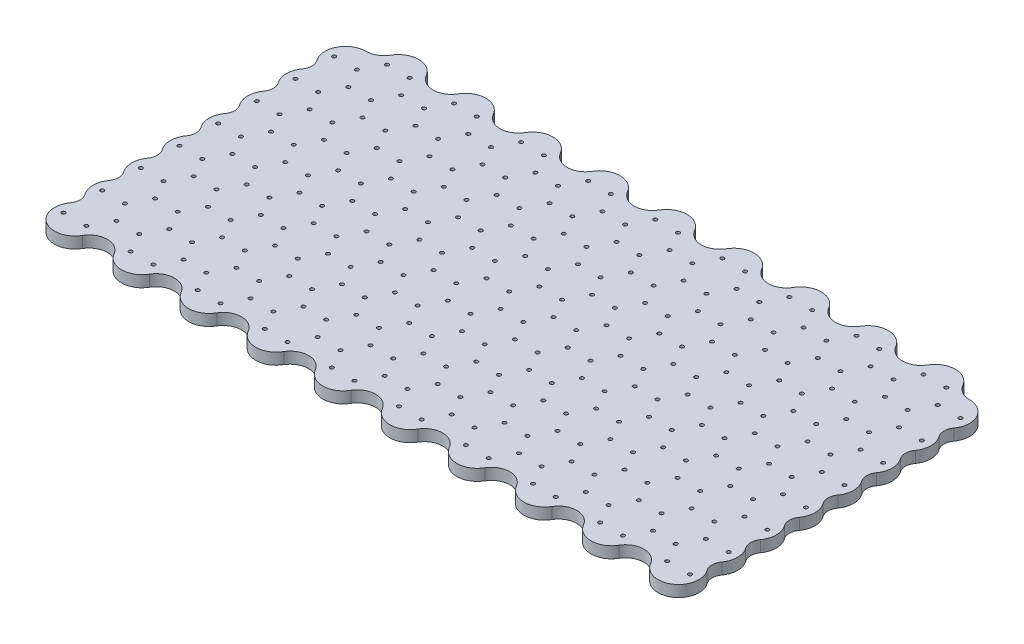
from build123d import *

# Parameters (mm, degrees)
AUFSATZ_LINEAR_AUSTRAGEN1_DEPTH = 5
SKIZZE2_R                       = 0.80000094
SCHNITT_LINEAR_AUSTRAGEN4_DEPTH = 237.30295198


with BuildPart() as part:
    # Skizze1 → Aufsatz-Linear austragen1 (new body)
    with BuildSketch(Plane(origin=(0, 0, 0), x_dir=(1, 0, 0), z_dir=(0, 1, 0))):
        with BuildLine():
            ThreePointArc((124.91553877, 48.070452206), (128.214927687, 44.726160241), (132.749999179, 43.500035234))
            ThreePointArc((132.749999179, 43.500035234), (140.744525423, 48.366339395), (140.093758122, 57.702819887))
            ThreePointArc((140.093758122, 57.702819887), (138.999081305, 61.000027141), (140.093758122, 64.297234395))
            ThreePointArc((140.093758122, 64.297234395), (141.32594072, 66.770002756), (141.749986955, 69.500028784))
            ThreePointArc((141.749986955, 69.500028784), (141.325938231, 72.230052813), (140.093754311, 74.702818735))
            ThreePointArc((140.093754311, 74.702818735), (138.99907647, 78.00002638), (140.093753094, 81.297234429))
            ThreePointArc((140.093753094, 81.297234429), (141.325935562, 83.770001959), (141.749982202, 86.500027112))
            ThreePointArc((141.749982202, 86.500027112), (141.325933853, 89.23005221), (140.093749716, 91.702819141))
            ThreePointArc((140.093749716, 91.702819141), (138.999072964, 95.000026021), (140.093749502, 98.297232972))
            ThreePointArc((140.093749502, 98.297232972), (141.32593197, 100.770000502), (141.74997861, 103.500025655))
            ThreePointArc((141.74997861, 103.500025655), (141.325930204, 106.230050932), (140.093745907, 108.702817989))
            ThreePointArc((140.093745907, 108.702817989), (138.999068066, 112.000025634), (140.09374469, 115.297233683))
            ThreePointArc((140.09374469, 115.297233683), (141.325927158, 117.770001213), (141.749973798, 120.500026366))
            ThreePointArc((141.749973798, 120.500026366), (141.325925449, 123.230051465), (140.093741312, 125.702818395))
            ThreePointArc((140.093741312, 125.702818395), (138.99906456, 129.000025275), (140.093741097, 132.297232226))
            ThreePointArc((140.093741097, 132.297232226), (141.325923565, 134.769999756), (141.749970205, 137.500024909))
            ThreePointArc((141.749970205, 137.500024909), (141.325921857, 140.230050008), (140.093737719, 142.702816938))
            ThreePointArc((140.093737719, 142.702816938), (138.999060902, 146.000024192), (140.093737719, 149.297231446))
            ThreePointArc((140.093737719, 149.297231446), (141.325919932, 151.769998598), (141.749966552, 154.500023296))
            ThreePointArc((141.749966552, 154.500023296), (141.325918528, 157.230047667), (140.093735107, 159.702814095))
            ThreePointArc((140.093735107, 159.702814095), (138.999100076, 163.000031939), (140.093814881, 166.297223297))
            ThreePointArc((140.093814881, 166.297223297), (140.7445807, 175.633710262), (132.750048262, 180.500016467))
            ThreePointArc((132.750048262, 180.500016467), (128.773042213, 181.551022776), (125.834510081, 184.429602337))
            ThreePointArc((125.834510081, 184.429602337), (122.535119401, 187.773893559), (118.0000473, 189.000019034))
            ThreePointArc((118.0000473, 189.000019034), (113.464976154, 187.773894117), (110.165585607, 184.429604261))
            ThreePointArc((110.165585607, 184.429604261), (107.227053085, 181.55102406), (103.250046244, 180.5000179))
            ThreePointArc((103.250046244, 180.5000179), (99.2730398, 181.551023834), (96.334507348, 184.429603476))
            ThreePointArc((96.334507348, 184.429603476), (93.035117029, 187.77389557), (88.50004465, 189.000021419))
            ThreePointArc((88.50004465, 189.000021419), (83.964973226, 187.773896127), (80.66558304, 184.429605401))
            ThreePointArc((80.66558304, 184.429605401), (77.72705055, 181.551025722), (73.750044055, 180.500019774))
            ThreePointArc((73.750044055, 180.500019774), (69.77303906, 181.551024869), (66.834506836, 184.429602437))
            ThreePointArc((66.834506836, 184.429602437), (63.535116518, 187.773894526), (59.000044142, 189.000020373))
            ThreePointArc((59.000044142, 189.000020373), (54.464972717, 187.773895081), (51.165582532, 184.429604355))
            ThreePointArc((51.165582532, 184.429604355), (48.227050241, 181.551024871), (44.250044015, 180.500018995))
            ThreePointArc((44.250044015, 180.500018995), (40.273039303, 181.551024011), (37.334507281, 184.429601364))
            ThreePointArc((37.334507281, 184.429601364), (34.035117292, 187.77389382), (29.50004493, 189.000019833))
            ThreePointArc((29.50004493, 189.000019833), (24.964974603, 187.773895007), (21.665584898, 184.429605465))
            ThreePointArc((21.665584898, 184.429605465), (18.727052209, 181.551025591), (14.750045444, 180.500019572))
            ThreePointArc((14.750045444, 180.500019572), (10.773039627, 181.551025052), (7.834507107, 184.429603591))
            ThreePointArc((7.834507107, 184.429603591), (4.535116988, 187.773895481), (4.4883e-05, 189.000021256))
            ThreePointArc((4.4883e-05, 189.000021256), (-4.535026263, 187.77389604), (-7.834416249, 184.429605522))
            ThreePointArc((-7.834416249, 184.429605522), (-10.772948771, 181.55102532), (-14.749955612, 180.500019161))
            ThreePointArc((-14.749955612, 180.500019161), (-18.726962056, 181.551025094), (-21.665494507, 184.429604737))
            ThreePointArc((-21.665494507, 184.429604737), (-24.964884922, 187.773895694), (-29.499956661, 189.000021072))
            ThreePointArc((-29.499956661, 189.000021072), (-34.035027446, 187.773896252), (-37.334417727, 184.429606661))
            ThreePointArc((-37.334417727, 184.429606661), (-40.272950615, 181.551026592), (-44.249957649, 180.500020502))
            ThreePointArc((-44.249957649, 180.500020502), (-48.226963749, 181.551026061), (-51.165496471, 184.429604814))
            ThreePointArc((-51.165496471, 184.429604814), (-54.464886685, 187.773895565), (-58.999958147, 189.000020866))
            ThreePointArc((-58.999958147, 189.000020866), (-63.535028653, 187.773896122), (-66.834418734, 184.429606739))
            ThreePointArc((-66.834418734, 184.429606739), (-69.772951257, 181.551026537), (-73.749958098, 180.500020378))
            ThreePointArc((-73.749958098, 180.500020378), (-77.726964541, 181.551026312), (-80.665496993, 184.429605954))
            ThreePointArc((-80.665496993, 184.429605954), (-83.964887112, 187.773897844), (-88.499959217, 189.000023619))
            ThreePointArc((-88.499959217, 189.000023619), (-93.035030363, 187.773898403), (-96.334420348, 184.429607885))
            ThreePointArc((-96.334420348, 184.429607885), (-99.27295287, 181.551027683), (-103.249959711, 180.500021524))
            ThreePointArc((-103.249959711, 180.500021524), (-107.226966155, 181.551027457), (-110.165498607, 184.4296071))
            ThreePointArc((-110.165498607, 184.4296071), (-113.464888926, 187.773899193), (-117.999961305, 189.000025042))
            ThreePointArc((-117.999961305, 189.000025042), (-122.535032729, 187.77389975), (-125.834422915, 184.429609024))
            ThreePointArc((-125.834422915, 184.429609024), (-128.772955367, 181.551029382), (-132.74996181, 180.500023448))
            ThreePointArc((-132.74996181, 180.500023448), (-140.744495653, 175.633717498), (-140.093729816, 166.297229465))
            ThreePointArc((-140.093729816, 166.297229465), (-138.999053343, 163.000022888), (-140.093729816, 159.702816312))
            ThreePointArc((-140.093729816, 159.702816312), (-141.325913281, 157.230049795), (-141.74996132, 154.500025326))
            ThreePointArc((-141.74996132, 154.500025326), (-141.325914628, 151.770000352), (-140.093732212, 149.297232985))
            ThreePointArc((-140.093732212, 149.297232985), (-138.999055588, 146.000024936), (-140.09373343, 142.702817292))
            ThreePointArc((-140.09373343, 142.702817292), (-141.325916851, 140.230050863), (-141.749964875, 137.500026492))
            ThreePointArc((-141.749964875, 137.500026492), (-141.325918255, 134.770001794), (-140.093736042, 132.297234643))
            ThreePointArc((-140.093736042, 132.297234643), (-138.999059139, 129.000026291), (-140.093737046, 125.702818272))
            ThreePointArc((-140.093737046, 125.702818272), (-141.325920467, 123.230051843), (-141.749968491, 120.500027472))
            ThreePointArc((-141.749968491, 120.500027472), (-141.325921871, 117.770002774), (-140.093739658, 115.297235623))
            ThreePointArc((-140.093739658, 115.297235623), (-138.999062841, 112.000028368), (-140.093739658, 108.702821114))
            ThreePointArc((-140.093739658, 108.702821114), (-141.325924679, 106.23005348), (-141.749973342, 103.500027394))
            ThreePointArc((-141.749973342, 103.500027394), (-141.325926702, 100.770002241), (-140.093744234, 98.297234711))
            ThreePointArc((-140.093744234, 98.297234711), (-138.99906761, 95.000026662), (-140.093745452, 91.702819017))
            ThreePointArc((-140.093745452, 91.702819017), (-141.325928873, 89.230052589), (-141.749976897, 86.500028218))
            ThreePointArc((-141.749976897, 86.500028218), (-141.325930277, 83.77000352), (-140.093748064, 81.297236368))
            ThreePointArc((-140.093748064, 81.297236368), (-138.999071247, 78.000029114), (-140.093748064, 74.70282186))
            ThreePointArc((-140.093748064, 74.70282186), (-141.325933042, 72.230054314), (-141.749981689, 69.500028326))
            ThreePointArc((-141.749981689, 69.500028326), (-141.325935121, 66.770003448), (-140.093752857, 64.297236134))
            ThreePointArc((-140.093752857, 64.297236134), (-138.99907604, 61.00002888), (-140.093752857, 57.702821626))
            ThreePointArc((-140.093752857, 57.702821626), (-140.74451982, 48.366336486), (-132.749988605, 43.500031618))
            ThreePointArc((-132.749988605, 43.500031618), (-128.214916303, 44.726158045), (-124.915527163, 48.070451408))
            ThreePointArc((-124.915527163, 48.070451408), (-121.976994711, 50.94903105), (-117.999988268, 52.000036984))
            ThreePointArc((-117.999988268, 52.000036984), (-114.02298144, 50.949030832), (-111.084448921, 48.07045065))
            ThreePointArc((-111.084448921, 48.07045065), (-107.78506094, 44.726158526), (-103.249990501, 43.500031703))
            ThreePointArc((-103.249990501, 43.500031703), (-98.714917302, 44.726157173), (-95.415527145, 48.070450399))
            ThreePointArc((-95.415527145, 48.070450399), (-92.476994693, 50.949030041), (-88.499988249, 52.000035975))
            ThreePointArc((-88.499988249, 52.000035975), (-84.522981408, 50.949029815), (-81.584448886, 48.070449614))
            ThreePointArc((-81.584448886, 48.070449614), (-78.28506064, 44.726157224), (-73.749989839, 43.500030305))
            ThreePointArc((-73.749989839, 43.500030305), (-69.214915735, 44.726156188), (-65.915525236, 48.070450456))
            ThreePointArc((-65.915525236, 48.070450456), (-62.976993214, 50.94902781), (-58.999988502, 52.000032826))
            ThreePointArc((-58.999988502, 52.000032826), (-55.022982276, 50.949026949), (-52.084449985, 48.070447465))
            ThreePointArc((-52.084449985, 48.070447465), (-48.785061388, 44.726155884), (-44.249990604, 43.500030167))
            ThreePointArc((-44.249990604, 43.500030167), (-39.714918865, 44.726156441), (-36.415530134, 48.07044939))
            ThreePointArc((-36.415530134, 48.07044939), (-33.476997682, 50.949029032), (-29.499991239, 52.000034966))
            ThreePointArc((-29.499991239, 52.000034966), (-25.522984412, 50.949028814), (-22.584451892, 48.070448632))
            ThreePointArc((-22.584451892, 48.070448632), (-19.285063295, 44.726157051), (-14.74999251, 43.500031334))
            ThreePointArc((-14.74999251, 43.500031334), (-10.214920771, 44.726157608), (-6.91553204, 48.070450557))
            ThreePointArc((-6.91553204, 48.070450557), (-3.976999589, 50.949030199), (6.855e-06, 52.000036133))
            ThreePointArc((6.855e-06, 52.000036133), (3.977013682, 50.949029981), (6.915546202, 48.070449799))
            ThreePointArc((6.915546202, 48.070449799), (10.21493528, 44.726157034), (14.750007161, 43.500030852))
            ThreePointArc((14.750007161, 43.500030852), (19.285079457, 44.726157276), (22.584468593, 48.070450636))
            ThreePointArc((22.584468593, 48.070450636), (25.523001045, 50.949030278), (29.500007489, 52.000036211))
            ThreePointArc((29.500007489, 52.000036211), (33.47701433, 50.949030052), (36.415546852, 48.07044985))
            ThreePointArc((36.415546852, 48.07044985), (39.714935249, 44.726158477), (44.250005755, 43.500032836))
            ThreePointArc((44.250005755, 43.500032836), (48.785077217, 44.726159034), (52.084465747, 48.070451775))
            ThreePointArc((52.084465747, 48.070451775), (55.02299797, 50.949029343), (59.000002966, 52.000034438))
            ThreePointArc((59.000002966, 52.000034438), (62.977009461, 50.949028491), (65.915541951, 48.070448811))
            ThreePointArc((65.915541951, 48.070448811), (69.214930548, 44.726157231), (73.750001332, 43.500031514))
            ThreePointArc((73.750001332, 43.500031514), (78.285073071, 44.726157788), (81.584461802, 48.070450736))
            ThreePointArc((81.584461802, 48.070450736), (84.522994254, 50.949030378), (88.500000697, 52.000036312))
            ThreePointArc((88.500000697, 52.000036312), (92.477007525, 50.94903016), (95.415540044, 48.070449978))
            ThreePointArc((95.415540044, 48.070449978), (98.714929739, 44.726157758), (103.250001966, 43.500032681))
            ThreePointArc((103.250001966, 43.500032681), (107.785072802, 44.72615991), (111.084460511, 48.070452991))
            ThreePointArc((111.084460511, 48.070452991), (114.022992963, 50.949032633), (117.999999406, 52.000038567))
            ThreePointArc((117.999999406, 52.000038567), (121.977006247, 50.949032408), (124.91553877, 48.070452206))
        make_face()
    extrude(amount=AUFSATZ_LINEAR_AUSTRAGEN1_DEPTH)

    # Skizze2 → Schnitt-Linear austragen4 (cut, through all)
    with BuildSketch(Plane(origin=(0, 0, 0), x_dir=(1, 0, 0), z_dir=(0, 1, 0))):
        with Locations((-137.74998532, 171.50002632)):
            Circle(SKIZZE2_R)
        with Locations((-127.749985, 171.50002632)):
            Circle(SKIZZE2_R)
        with Locations((-127.749985, 154.50002476)):
            Circle(SKIZZE2_R)
        with Locations((-137.74998532, 154.50002476)):
            Circle(SKIZZE2_R)
        with Locations((-127.749985, 137.50002574)):
            Circle(SKIZZE2_R)
        with Locations((-137.74998532, 137.50002574)):
            Circle(SKIZZE2_R)
        with Locations((-127.749985, 120.50002672)):
            Circle(SKIZZE2_R)
        with Locations((-137.74998532, 120.50002672)):
            Circle(SKIZZE2_R)
        with Locations((-127.749985, 103.50002516)):
            Circle(SKIZZE2_R)
        with Locations((-137.74998532, 103.50002516)):
            Circle(SKIZZE2_R)
        with Locations((-137.74998532, 86.50002614)):
            Circle(SKIZZE2_R)
        with Locations((-127.749985, 86.50002614)):
            Circle(SKIZZE2_R)
        with Locations((-137.74998532, 69.50002458)):
            Circle(SKIZZE2_R)
        with Locations((-127.749985, 69.50002458)):
            Circle(SKIZZE2_R)
        with Locations((-137.74998532, 52.50002556)):
            Circle(SKIZZE2_R)
        with Locations((-127.749985, 52.50002556)):
            Circle(SKIZZE2_R)
        with Locations((-122.99998434, 180.0000271)):
            Circle(SKIZZE2_R)
        with Locations((-112.99998402, 180.0000271)):
            Circle(SKIZZE2_R)
        with Locations((-112.99998402, 163.00002554)):
            Circle(SKIZZE2_R)
        with Locations((-122.99998434, 163.00002554)):
            Circle(SKIZZE2_R)
        with Locations((-112.99998402, 146.00002652)):
            Circle(SKIZZE2_R)
        with Locations((-122.99998434, 146.00002652)):
            Circle(SKIZZE2_R)
        with Locations((-112.99998402, 129.0000275)):
            Circle(SKIZZE2_R)
        with Locations((-122.99998434, 129.0000275)):
            Circle(SKIZZE2_R)
        with Locations((-112.99998402, 112.00002594)):
            Circle(SKIZZE2_R)
        with Locations((-122.99998434, 112.00002594)):
            Circle(SKIZZE2_R)
        with Locations((-122.99998434, 95.00002692)):
            Circle(SKIZZE2_R)
        with Locations((-112.99998402, 95.00002692)):
            Circle(SKIZZE2_R)
        with Locations((-122.99998434, 78.00002536)):
            Circle(SKIZZE2_R)
        with Locations((-112.99998402, 78.00002536)):
            Circle(SKIZZE2_R)
        with Locations((-122.99998434, 61.00002634)):
            Circle(SKIZZE2_R)
        with Locations((-112.99998402, 61.00002634)):
            Circle(SKIZZE2_R)
        with Locations((-108.24998336, 171.50002632)):
            Circle(SKIZZE2_R)
        with Locations((-98.24998304, 171.50002632)):
            Circle(SKIZZE2_R)
        with Locations((-98.24998304, 154.50002476)):
            Circle(SKIZZE2_R)
        with Locations((-108.24998336, 154.50002476)):
            Circle(SKIZZE2_R)
        with Locations((-98.24998304, 137.50002574)):
            Circle(SKIZZE2_R)
        with Locations((-108.24998336, 137.50002574)):
            Circle(SKIZZE2_R)
        with Locations((-98.24998304, 120.50002672)):
            Circle(SKIZZE2_R)
        with Locations((-108.24998336, 120.50002672)):
            Circle(SKIZZE2_R)
        with Locations((-98.24998304, 103.50002516)):
            Circle(SKIZZE2_R)
        with Locations((-108.24998336, 103.50002516)):
            Circle(SKIZZE2_R)
        with Locations((-108.24998336, 86.50002614)):
            Circle(SKIZZE2_R)
        with Locations((-98.24998304, 86.50002614)):
            Circle(SKIZZE2_R)
        with Locations((-108.24998336, 69.50002458)):
            Circle(SKIZZE2_R)
        with Locations((-98.24998304, 69.50002458)):
            Circle(SKIZZE2_R)
        with Locations((-108.24998336, 52.50002556)):
            Circle(SKIZZE2_R)
        with Locations((-98.24998304, 52.50002556)):
            Circle(SKIZZE2_R)
        with Locations((-93.49998492, 180.0000271)):
            Circle(SKIZZE2_R)
        with Locations((-83.4999846, 180.0000271)):
            Circle(SKIZZE2_R)
        with Locations((-83.4999846, 163.00002554)):
            Circle(SKIZZE2_R)
        with Locations((-93.49998492, 163.00002554)):
            Circle(SKIZZE2_R)
        with Locations((-83.4999846, 146.00002652)):
            Circle(SKIZZE2_R)
        with Locations((-93.49998492, 146.00002652)):
            Circle(SKIZZE2_R)
        with Locations((-83.4999846, 129.0000275)):
            Circle(SKIZZE2_R)
        with Locations((-93.49998492, 129.0000275)):
            Circle(SKIZZE2_R)
        with Locations((-83.4999846, 112.00002594)):
            Circle(SKIZZE2_R)
        with Locations((-93.49998492, 112.00002594)):
            Circle(SKIZZE2_R)
        with Locations((-93.49998492, 95.00002692)):
            Circle(SKIZZE2_R)
        with Locations((-83.4999846, 95.00002692)):
            Circle(SKIZZE2_R)
        with Locations((-93.49998492, 78.00002536)):
            Circle(SKIZZE2_R)
        with Locations((-83.4999846, 78.00002536)):
            Circle(SKIZZE2_R)
        with Locations((-93.49998492, 61.00002634)):
            Circle(SKIZZE2_R)
        with Locations((-83.4999846, 61.00002634)):
            Circle(SKIZZE2_R)
        with Locations((-78.74998394, 171.50002632)):
            Circle(SKIZZE2_R)
        with Locations((-68.74998362, 171.50002632)):
            Circle(SKIZZE2_R)
        with Locations((-68.74998362, 154.50002476)):
            Circle(SKIZZE2_R)
        with Locations((-78.74998394, 154.50002476)):
            Circle(SKIZZE2_R)
        with Locations((-68.74998362, 137.50002574)):
            Circle(SKIZZE2_R)
        with Locations((-78.74998394, 137.50002574)):
            Circle(SKIZZE2_R)
        with Locations((-68.74998362, 120.50002672)):
            Circle(SKIZZE2_R)
        with Locations((-78.74998394, 120.50002672)):
            Circle(SKIZZE2_R)
        with Locations((-68.74998362, 103.50002516)):
            Circle(SKIZZE2_R)
        with Locations((-78.74998394, 103.50002516)):
            Circle(SKIZZE2_R)
        with Locations((-78.74998394, 86.50002614)):
            Circle(SKIZZE2_R)
        with Locations((-68.74998362, 86.50002614)):
            Circle(SKIZZE2_R)
        with Locations((-78.74998394, 69.50002458)):
            Circle(SKIZZE2_R)
        with Locations((-68.74998362, 69.50002458)):
            Circle(SKIZZE2_R)
        with Locations((-78.74998394, 52.50002556)):
            Circle(SKIZZE2_R)
        with Locations((-68.74998362, 52.50002556)):
            Circle(SKIZZE2_R)
        with Locations((-63.9999855, 180.00002456)):
            Circle(SKIZZE2_R)
        with Locations((-53.99998518, 180.00002456)):
            Circle(SKIZZE2_R)
        with Locations((-53.99998518, 163.000023)):
            Circle(SKIZZE2_R)
        with Locations((-63.9999855, 163.000023)):
            Circle(SKIZZE2_R)
        with Locations((-53.99998518, 146.00002398)):
            Circle(SKIZZE2_R)
        with Locations((-63.9999855, 146.00002398)):
            Circle(SKIZZE2_R)
        with Locations((-53.99998518, 129.00002496)):
            Circle(SKIZZE2_R)
        with Locations((-63.9999855, 129.00002496)):
            Circle(SKIZZE2_R)
        with Locations((-53.99998518, 112.0000234)):
            Circle(SKIZZE2_R)
        with Locations((-63.9999855, 112.0000234)):
            Circle(SKIZZE2_R)
        with Locations((-63.9999855, 95.00002438)):
            Circle(SKIZZE2_R)
        with Locations((-53.99998518, 95.00002438)):
            Circle(SKIZZE2_R)
        with Locations((-63.9999855, 78.00002282)):
            Circle(SKIZZE2_R)
        with Locations((-53.99998518, 78.00002282)):
            Circle(SKIZZE2_R)
        with Locations((-63.9999855, 61.0000238)):
            Circle(SKIZZE2_R)
        with Locations((-53.99998518, 61.0000238)):
            Circle(SKIZZE2_R)
        with Locations((-49.24998452, 171.50002632)):
            Circle(SKIZZE2_R)
        with Locations((-39.2499842, 171.50002632)):
            Circle(SKIZZE2_R)
        with Locations((-39.2499842, 154.50002476)):
            Circle(SKIZZE2_R)
        with Locations((-49.24998452, 154.50002476)):
            Circle(SKIZZE2_R)
        with Locations((-39.2499842, 137.50002574)):
            Circle(SKIZZE2_R)
        with Locations((-49.24998452, 137.50002574)):
            Circle(SKIZZE2_R)
        with Locations((-39.2499842, 120.50002672)):
            Circle(SKIZZE2_R)
        with Locations((-49.24998452, 120.50002672)):
            Circle(SKIZZE2_R)
        with Locations((-39.2499842, 103.50002516)):
            Circle(SKIZZE2_R)
        with Locations((-49.24998452, 103.50002516)):
            Circle(SKIZZE2_R)
        with Locations((-49.24998452, 86.50002614)):
            Circle(SKIZZE2_R)
        with Locations((-39.2499842, 86.50002614)):
            Circle(SKIZZE2_R)
        with Locations((-49.24998452, 69.50002458)):
            Circle(SKIZZE2_R)
        with Locations((-39.2499842, 69.50002458)):
            Circle(SKIZZE2_R)
        with Locations((-49.24998452, 52.50002556)):
            Circle(SKIZZE2_R)
        with Locations((-39.2499842, 52.50002556)):
            Circle(SKIZZE2_R)
        with Locations((-34.49998354, 180.00002456)):
            Circle(SKIZZE2_R)
        with Locations((-24.49998322, 180.00002456)):
            Circle(SKIZZE2_R)
        with Locations((-24.49998322, 163.000023)):
            Circle(SKIZZE2_R)
        with Locations((-34.49998354, 163.000023)):
            Circle(SKIZZE2_R)
        with Locations((-24.49998322, 146.00002398)):
            Circle(SKIZZE2_R)
        with Locations((-34.49998354, 146.00002398)):
            Circle(SKIZZE2_R)
        with Locations((-24.49998322, 129.00002496)):
            Circle(SKIZZE2_R)
        with Locations((-34.49998354, 129.00002496)):
            Circle(SKIZZE2_R)
        with Locations((-24.49998322, 112.0000234)):
            Circle(SKIZZE2_R)
        with Locations((-34.49998354, 112.0000234)):
            Circle(SKIZZE2_R)
        with Locations((-34.49998354, 95.00002438)):
            Circle(SKIZZE2_R)
        with Locations((-24.49998322, 95.00002438)):
            Circle(SKIZZE2_R)
        with Locations((-34.49998354, 78.00002282)):
            Circle(SKIZZE2_R)
        with Locations((-24.49998322, 78.00002282)):
            Circle(SKIZZE2_R)
        with Locations((-34.49998354, 61.0000238)):
            Circle(SKIZZE2_R)
        with Locations((-24.49998322, 61.0000238)):
            Circle(SKIZZE2_R)
        with Locations((-19.7499851, 171.50002632)):
            Circle(SKIZZE2_R)
        with Locations((-9.74998478, 171.50002632)):
            Circle(SKIZZE2_R)
        with Locations((-9.74998478, 154.50002476)):
            Circle(SKIZZE2_R)
        with Locations((-19.7499851, 154.50002476)):
            Circle(SKIZZE2_R)
        with Locations((-9.74998478, 137.50002574)):
            Circle(SKIZZE2_R)
        with Locations((-19.7499851, 137.50002574)):
            Circle(SKIZZE2_R)
        with Locations((-9.74998478, 120.50002672)):
            Circle(SKIZZE2_R)
        with Locations((-19.7499851, 120.50002672)):
            Circle(SKIZZE2_R)
        with Locations((-9.74998478, 103.50002516)):
            Circle(SKIZZE2_R)
        with Locations((-19.7499851, 103.50002516)):
            Circle(SKIZZE2_R)
        with Locations((-19.7499851, 86.50002614)):
            Circle(SKIZZE2_R)
        with Locations((-9.74998478, 86.50002614)):
            Circle(SKIZZE2_R)
        with Locations((-19.7499851, 69.50002458)):
            Circle(SKIZZE2_R)
        with Locations((-9.74998478, 69.50002458)):
            Circle(SKIZZE2_R)
        with Locations((-19.7499851, 52.50002556)):
            Circle(SKIZZE2_R)
        with Locations((-9.74998478, 52.50002556)):
            Circle(SKIZZE2_R)
        with Locations((127.75001454, 171.50002378)):
            Circle(SKIZZE2_R)
        with Locations((137.75001486, 171.50002378)):
            Circle(SKIZZE2_R)
        with Locations((137.75001486, 154.50002222)):
            Circle(SKIZZE2_R)
        with Locations((127.75001454, 154.50002222)):
            Circle(SKIZZE2_R)
        with Locations((137.75001486, 137.5000232)):
            Circle(SKIZZE2_R)
        with Locations((127.75001454, 137.5000232)):
            Circle(SKIZZE2_R)
        with Locations((137.75001486, 120.50002418)):
            Circle(SKIZZE2_R)
        with Locations((127.75001454, 120.50002418)):
            Circle(SKIZZE2_R)
        with Locations((137.75001486, 103.50002262)):
            Circle(SKIZZE2_R)
        with Locations((127.75001454, 103.50002262)):
            Circle(SKIZZE2_R)
        with Locations((127.75001454, 86.5000236)):
            Circle(SKIZZE2_R)
        with Locations((137.75001486, 86.5000236)):
            Circle(SKIZZE2_R)
        with Locations((127.75001454, 69.50002204)):
            Circle(SKIZZE2_R)
        with Locations((137.75001486, 69.50002204)):
            Circle(SKIZZE2_R)
        with Locations((127.75001454, 52.50002302)):
            Circle(SKIZZE2_R)
        with Locations((137.75001486, 52.50002302)):
            Circle(SKIZZE2_R)
        with Locations((113.0000161, 180.00002456)):
            Circle(SKIZZE2_R)
        with Locations((123.00001642, 180.00002456)):
            Circle(SKIZZE2_R)
        with Locations((123.00001642, 163.000023)):
            Circle(SKIZZE2_R)
        with Locations((113.0000161, 163.000023)):
            Circle(SKIZZE2_R)
        with Locations((123.00001642, 146.00002398)):
            Circle(SKIZZE2_R)
        with Locations((113.0000161, 146.00002398)):
            Circle(SKIZZE2_R)
        with Locations((123.00001642, 129.00002496)):
            Circle(SKIZZE2_R)
        with Locations((113.0000161, 129.00002496)):
            Circle(SKIZZE2_R)
        with Locations((123.00001642, 112.0000234)):
            Circle(SKIZZE2_R)
        with Locations((113.0000161, 112.0000234)):
            Circle(SKIZZE2_R)
        with Locations((113.0000161, 95.00002438)):
            Circle(SKIZZE2_R)
        with Locations((123.00001642, 95.00002438)):
            Circle(SKIZZE2_R)
        with Locations((113.0000161, 78.00002282)):
            Circle(SKIZZE2_R)
        with Locations((123.00001642, 78.00002282)):
            Circle(SKIZZE2_R)
        with Locations((113.0000161, 61.0000238)):
            Circle(SKIZZE2_R)
        with Locations((123.00001642, 61.0000238)):
            Circle(SKIZZE2_R)
        with Locations((98.25001512, 171.50002632)):
            Circle(SKIZZE2_R)
        with Locations((108.25001544, 171.50002632)):
            Circle(SKIZZE2_R)
        with Locations((108.25001544, 154.50002476)):
            Circle(SKIZZE2_R)
        with Locations((98.25001512, 154.50002476)):
            Circle(SKIZZE2_R)
        with Locations((108.25001544, 137.50002574)):
            Circle(SKIZZE2_R)
        with Locations((98.25001512, 137.50002574)):
            Circle(SKIZZE2_R)
        with Locations((108.25001544, 120.50002672)):
            Circle(SKIZZE2_R)
        with Locations((98.25001512, 120.50002672)):
            Circle(SKIZZE2_R)
        with Locations((108.25001544, 103.50002516)):
            Circle(SKIZZE2_R)
        with Locations((98.25001512, 103.50002516)):
            Circle(SKIZZE2_R)
        with Locations((98.25001512, 86.50002614)):
            Circle(SKIZZE2_R)
        with Locations((108.25001544, 86.50002614)):
            Circle(SKIZZE2_R)
        with Locations((98.25001512, 69.50002458)):
            Circle(SKIZZE2_R)
        with Locations((108.25001544, 69.50002458)):
            Circle(SKIZZE2_R)
        with Locations((98.25001512, 52.50002556)):
            Circle(SKIZZE2_R)
        with Locations((108.25001544, 52.50002556)):
            Circle(SKIZZE2_R)
        with Locations((83.50001668, 180.0000271)):
            Circle(SKIZZE2_R)
        with Locations((93.500017, 180.0000271)):
            Circle(SKIZZE2_R)
        with Locations((93.500017, 163.00002554)):
            Circle(SKIZZE2_R)
        with Locations((83.50001668, 163.00002554)):
            Circle(SKIZZE2_R)
        with Locations((93.500017, 146.00002652)):
            Circle(SKIZZE2_R)
        with Locations((83.50001668, 146.00002652)):
            Circle(SKIZZE2_R)
        with Locations((93.500017, 129.0000275)):
            Circle(SKIZZE2_R)
        with Locations((83.50001668, 129.0000275)):
            Circle(SKIZZE2_R)
        with Locations((93.500017, 112.00002594)):
            Circle(SKIZZE2_R)
        with Locations((83.50001668, 112.00002594)):
            Circle(SKIZZE2_R)
        with Locations((83.50001668, 95.00002692)):
            Circle(SKIZZE2_R)
        with Locations((93.500017, 95.00002692)):
            Circle(SKIZZE2_R)
        with Locations((83.50001668, 78.00002536)):
            Circle(SKIZZE2_R)
        with Locations((93.500017, 78.00002536)):
            Circle(SKIZZE2_R)
        with Locations((83.50001668, 61.00002634)):
            Circle(SKIZZE2_R)
        with Locations((93.500017, 61.00002634)):
            Circle(SKIZZE2_R)
        with Locations((68.7500157, 171.50002632)):
            Circle(SKIZZE2_R)
        with Locations((78.75001602, 171.50002632)):
            Circle(SKIZZE2_R)
        with Locations((78.75001602, 154.50002476)):
            Circle(SKIZZE2_R)
        with Locations((68.7500157, 154.50002476)):
            Circle(SKIZZE2_R)
        with Locations((78.75001602, 137.50002574)):
            Circle(SKIZZE2_R)
        with Locations((68.7500157, 137.50002574)):
            Circle(SKIZZE2_R)
        with Locations((78.75001602, 120.50002672)):
            Circle(SKIZZE2_R)
        with Locations((68.7500157, 120.50002672)):
            Circle(SKIZZE2_R)
        with Locations((78.75001602, 103.50002516)):
            Circle(SKIZZE2_R)
        with Locations((68.7500157, 103.50002516)):
            Circle(SKIZZE2_R)
        with Locations((68.7500157, 86.50002614)):
            Circle(SKIZZE2_R)
        with Locations((78.75001602, 86.50002614)):
            Circle(SKIZZE2_R)
        with Locations((68.7500157, 69.50002458)):
            Circle(SKIZZE2_R)
        with Locations((78.75001602, 69.50002458)):
            Circle(SKIZZE2_R)
        with Locations((68.7500157, 52.50002556)):
            Circle(SKIZZE2_R)
        with Locations((78.75001602, 52.50002556)):
            Circle(SKIZZE2_R)
        with Locations((54.00001726, 180.0000271)):
            Circle(SKIZZE2_R)
        with Locations((64.00001758, 180.0000271)):
            Circle(SKIZZE2_R)
        with Locations((64.00001758, 163.00002554)):
            Circle(SKIZZE2_R)
        with Locations((54.00001726, 163.00002554)):
            Circle(SKIZZE2_R)
        with Locations((64.00001758, 146.00002652)):
            Circle(SKIZZE2_R)
        with Locations((54.00001726, 146.00002652)):
            Circle(SKIZZE2_R)
        with Locations((64.00001758, 129.0000275)):
            Circle(SKIZZE2_R)
        with Locations((54.00001726, 129.0000275)):
            Circle(SKIZZE2_R)
        with Locations((64.00001758, 112.00002594)):
            Circle(SKIZZE2_R)
        with Locations((54.00001726, 112.00002594)):
            Circle(SKIZZE2_R)
        with Locations((54.00001726, 95.00002692)):
            Circle(SKIZZE2_R)
        with Locations((64.00001758, 95.00002692)):
            Circle(SKIZZE2_R)
        with Locations((54.00001726, 78.00002536)):
            Circle(SKIZZE2_R)
        with Locations((64.00001758, 78.00002536)):
            Circle(SKIZZE2_R)
        with Locations((54.00001726, 61.00002634)):
            Circle(SKIZZE2_R)
        with Locations((64.00001758, 61.00002634)):
            Circle(SKIZZE2_R)
        with Locations((39.25001628, 171.50002632)):
            Circle(SKIZZE2_R)
        with Locations((49.2500166, 171.50002632)):
            Circle(SKIZZE2_R)
        with Locations((49.2500166, 154.50002476)):
            Circle(SKIZZE2_R)
        with Locations((39.25001628, 154.50002476)):
            Circle(SKIZZE2_R)
        with Locations((49.2500166, 137.50002574)):
            Circle(SKIZZE2_R)
        with Locations((39.25001628, 137.50002574)):
            Circle(SKIZZE2_R)
        with Locations((49.2500166, 120.50002672)):
            Circle(SKIZZE2_R)
        with Locations((39.25001628, 120.50002672)):
            Circle(SKIZZE2_R)
        with Locations((49.2500166, 103.50002516)):
            Circle(SKIZZE2_R)
        with Locations((39.25001628, 103.50002516)):
            Circle(SKIZZE2_R)
        with Locations((39.25001628, 86.50002614)):
            Circle(SKIZZE2_R)
        with Locations((49.2500166, 86.50002614)):
            Circle(SKIZZE2_R)
        with Locations((39.25001628, 69.50002458)):
            Circle(SKIZZE2_R)
        with Locations((49.2500166, 69.50002458)):
            Circle(SKIZZE2_R)
        with Locations((39.25001628, 52.50002556)):
            Circle(SKIZZE2_R)
        with Locations((49.2500166, 52.50002556)):
            Circle(SKIZZE2_R)
        with Locations((24.5000153, 180.0000271)):
            Circle(SKIZZE2_R)
        with Locations((34.50001562, 180.0000271)):
            Circle(SKIZZE2_R)
        with Locations((34.50001562, 163.00002554)):
            Circle(SKIZZE2_R)
        with Locations((24.5000153, 163.00002554)):
            Circle(SKIZZE2_R)
        with Locations((34.50001562, 146.00002652)):
            Circle(SKIZZE2_R)
        with Locations((24.5000153, 146.00002652)):
            Circle(SKIZZE2_R)
        with Locations((34.50001562, 129.0000275)):
            Circle(SKIZZE2_R)
        with Locations((24.5000153, 129.0000275)):
            Circle(SKIZZE2_R)
        with Locations((34.50001562, 112.00002594)):
            Circle(SKIZZE2_R)
        with Locations((24.5000153, 112.00002594)):
            Circle(SKIZZE2_R)
        with Locations((24.5000153, 95.00002692)):
            Circle(SKIZZE2_R)
        with Locations((34.50001562, 95.00002692)):
            Circle(SKIZZE2_R)
        with Locations((24.5000153, 78.00002536)):
            Circle(SKIZZE2_R)
        with Locations((34.50001562, 78.00002536)):
            Circle(SKIZZE2_R)
        with Locations((24.5000153, 61.00002634)):
            Circle(SKIZZE2_R)
        with Locations((34.50001562, 61.00002634)):
            Circle(SKIZZE2_R)
        with Locations((9.75001686, 171.50002632)):
            Circle(SKIZZE2_R)
        with Locations((19.75001718, 171.50002632)):
            Circle(SKIZZE2_R)
        with Locations((19.75001718, 154.50002476)):
            Circle(SKIZZE2_R)
        with Locations((9.75001686, 154.50002476)):
            Circle(SKIZZE2_R)
        with Locations((19.75001718, 137.50002574)):
            Circle(SKIZZE2_R)
        with Locations((9.75001686, 137.50002574)):
            Circle(SKIZZE2_R)
        with Locations((19.75001718, 120.50002672)):
            Circle(SKIZZE2_R)
        with Locations((9.75001686, 120.50002672)):
            Circle(SKIZZE2_R)
        with Locations((19.75001718, 103.50002516)):
            Circle(SKIZZE2_R)
        with Locations((9.75001686, 103.50002516)):
            Circle(SKIZZE2_R)
        with Locations((9.75001686, 86.50002614)):
            Circle(SKIZZE2_R)
        with Locations((19.75001718, 86.50002614)):
            Circle(SKIZZE2_R)
        with Locations((9.75001686, 69.50002458)):
            Circle(SKIZZE2_R)
        with Locations((19.75001718, 69.50002458)):
            Circle(SKIZZE2_R)
        with Locations((9.75001686, 52.50002556)):
            Circle(SKIZZE2_R)
        with Locations((19.75001718, 52.50002556)):
            Circle(SKIZZE2_R)
        with Locations((5.0000162, 61.00002634)):
            Circle(SKIZZE2_R)
        with Locations((-4.99998412, 61.00002634)):
            Circle(SKIZZE2_R)
        with Locations((5.0000162, 78.00002536)):
            Circle(SKIZZE2_R)
        with Locations((-4.99998412, 78.00002536)):
            Circle(SKIZZE2_R)
        with Locations((5.0000162, 95.00002692)):
            Circle(SKIZZE2_R)
        with Locations((-4.99998412, 95.00002692)):
            Circle(SKIZZE2_R)
        with Locations((-4.99998412, 112.00002594)):
            Circle(SKIZZE2_R)
        with Locations((5.0000162, 112.00002594)):
            Circle(SKIZZE2_R)
        with Locations((-4.99998412, 129.0000275)):
            Circle(SKIZZE2_R)
        with Locations((5.0000162, 129.0000275)):
            Circle(SKIZZE2_R)
        with Locations((-4.99998412, 146.00002652)):
            Circle(SKIZZE2_R)
        with Locations((5.0000162, 146.00002652)):
            Circle(SKIZZE2_R)
        with Locations((-4.99998412, 163.00002554)):
            Circle(SKIZZE2_R)
        with Locations((5.0000162, 163.00002554)):
            Circle(SKIZZE2_R)
        with Locations((5.0000162, 180.0000271)):
            Circle(SKIZZE2_R)
        with Locations((-4.99998412, 180.0000271)):
            Circle(SKIZZE2_R)
    extrude(amount=SCHNITT_LINEAR_AUSTRAGEN4_DEPTH, mode=Mode.SUBTRACT)


solid = part.part
